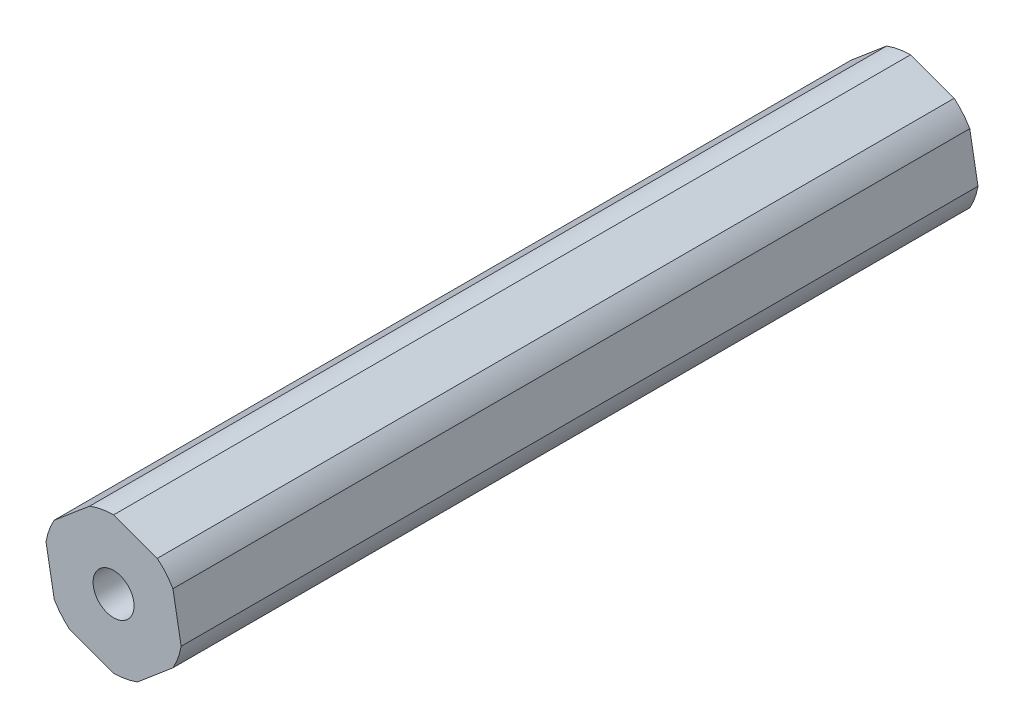
from build123d import *

# Parameters (mm, degrees)
BOSS_EXTRUDE1_DEPTH = 78.486
SKETCH2_R           = 2.0193
CUT_EXTRUDE1_DEPTH  = 80.056293928


with BuildPart() as part:
    # Sketch1 → Boss-Extrude1 (new body)
    with BuildSketch(Plane.XY):
        with BuildLine():
            Line((-6.654540832, 1.131188008), (-5.845671476, -3.375))
            ThreePointArc((-5.845671476, -3.375), (-5.15742276, -4.354709), (-4.306907968, -5.197407407))
            Line((-4.306907968, -5.197407407), (0, -6.75))
            ThreePointArc((0, -6.75), (1.19257724, -6.643813628), (2.347632865, -6.328595415))
            Line((2.347632865, -6.328595415), (5.845671476, -3.375))
            ThreePointArc((5.845671476, -3.375), (6.35, -2.289104628), (6.654540832, -1.131188008))
            Line((6.654540832, -1.131188008), (5.845671476, 3.375))
            ThreePointArc((5.845671476, 3.375), (5.15742276, 4.354709), (4.306907968, 5.197407407))
            Line((4.306907968, 5.197407407), (0, 6.75))
            ThreePointArc((0, 6.75), (-1.19257724, 6.643813628), (-2.347632865, 6.328595415))
            Line((-2.347632865, 6.328595415), (-5.845671476, 3.375))
            ThreePointArc((-5.845671476, 3.375), (-6.35, 2.289104628), (-6.654540832, 1.131188008))
        make_face()
    extrude(amount=BOSS_EXTRUDE1_DEPTH)

    # Sketch2 → Cut-Extrude1 (cut, through all)
    with BuildSketch(Plane.XY.offset(78.486)):
        Circle(SKETCH2_R)
    extrude(amount=-CUT_EXTRUDE1_DEPTH, mode=Mode.SUBTRACT)


solid = part.part
